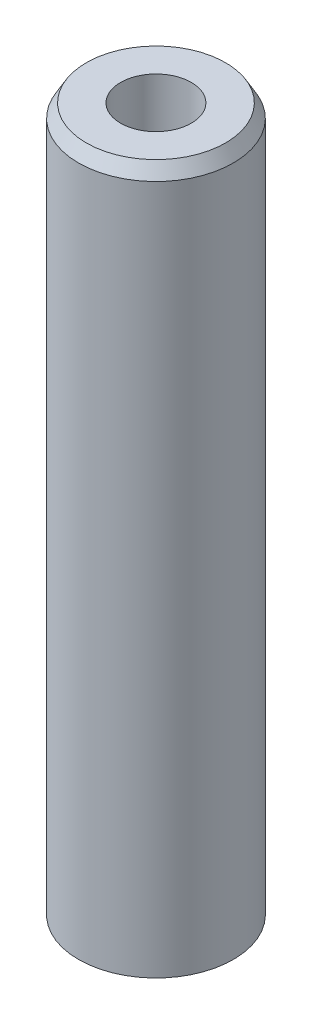
from build123d import *
from OCP.BRepFilletAPI import BRepFilletAPI_MakeChamfer

# Parameters (mm, degrees)
SKETCH1_R           = 32.5
BOSS_EXTRUDE1_DEPTH = 298.679103881
SKETCH2_R           = 14.852963866
CUT_EXTRUDE1_DEPTH  = 303.19481646
CHAMFER1_SIZE       = 5.660163059
CHAMFER1_SIZE2      = 3.267896666


with BuildPart() as part:
    # Sketch1 → Boss-Extrude1 (new body)
    with BuildSketch(Plane(origin=(0, 0, 0), x_dir=(1, 0, 0), z_dir=(0, 1, 0))):
        Circle(SKETCH1_R)
    extrude(amount=BOSS_EXTRUDE1_DEPTH)

    # Sketch2 → Cut-Extrude1 (cut, through all)
    with BuildSketch(Plane(origin=(0, 0, 0), x_dir=(1, 0, 0), z_dir=(0, 1, 0))):
        Circle(SKETCH2_R)
    extrude(amount=CUT_EXTRUDE1_DEPTH, mode=Mode.SUBTRACT)

    # Chamfer1: one chamfer whose edges measure the first distance from different faces: ONE call of the kernel's chamfer builder (chamfer() names one face for all edges)
    chamfer1_edges_1 = [part.edges().sort_by_distance(p)[0] for p in [
        (-32.5, 298.679103881, 0),
    ]]
    chamfer1_side_1 = [part.faces().sort_by_distance(p)[0] for p in [
        (-32.5, 149.33955194, 0),
    ]]
    chamfer1_edges_2 = [part.edges().sort_by_distance(p)[0] for p in [
        (-32.5, 0, 0),
    ]]
    chamfer1_side_2 = [part.faces().sort_by_distance(p)[0] for p in [
        (-31.580761184, 0, 0),
    ]]
    chamfer1 = BRepFilletAPI_MakeChamfer(part.part.solid().wrapped)
    for e in chamfer1_edges_1:
        chamfer1.Add(CHAMFER1_SIZE, CHAMFER1_SIZE2, e.wrapped, chamfer1_side_1[0].wrapped)  # the first distance lies on this face
    for e in chamfer1_edges_2:
        chamfer1.Add(CHAMFER1_SIZE, CHAMFER1_SIZE2, e.wrapped, chamfer1_side_2[0].wrapped)  # the first distance lies on this face
    add(Compound.cast(chamfer1.Shape()), mode=Mode.REPLACE)


solid = part.part
